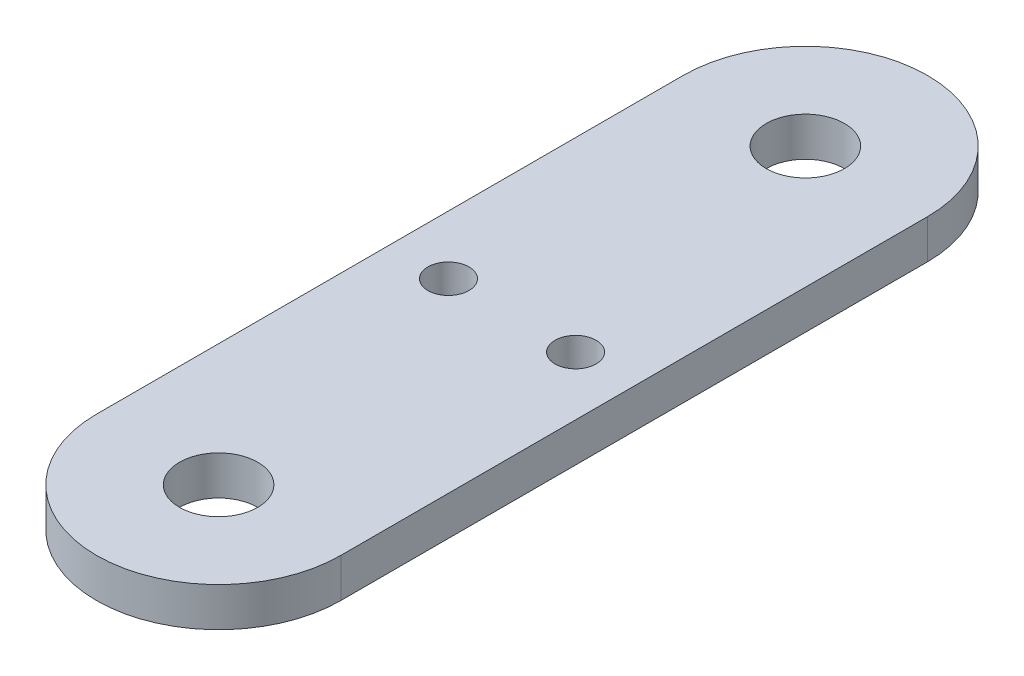
from build123d import *

# Parameters (mm, degrees)
SKETCH1_R           = 4
SKETCH1_R_2         = 2.1
BOSS_EXTRUDE1_DEPTH = 4


with BuildPart() as part:
    # Sketch1 → Boss-Extrude1 (new body)
    with BuildSketch(Plane(origin=(0, 0, 0), x_dir=(1, 0, 0), z_dir=(0, 1, 0))):
        with BuildLine():
            ThreePointArc((-12.5, -30), (0, -42.5), (12.5, -30))
            Line((12.5, -30), (12.5, 30))
            ThreePointArc((12.5, 30), (4e-09, 42.5), (-12.5, 30.000000007))
            Line((-12.5, 30.000000007), (-12.5, -30))
        make_face()
        with Locations((0, -30)):
            Circle(SKETCH1_R, mode=Mode.SUBTRACT)
        with Locations((6.5, 0)):
            Circle(SKETCH1_R_2, mode=Mode.SUBTRACT)
        with Locations((-6.5, 0)):
            Circle(SKETCH1_R_2, mode=Mode.SUBTRACT)
        with Locations((0, 30)):
            Circle(SKETCH1_R, mode=Mode.SUBTRACT)
    extrude(amount=BOSS_EXTRUDE1_DEPTH)


solid = part.part
